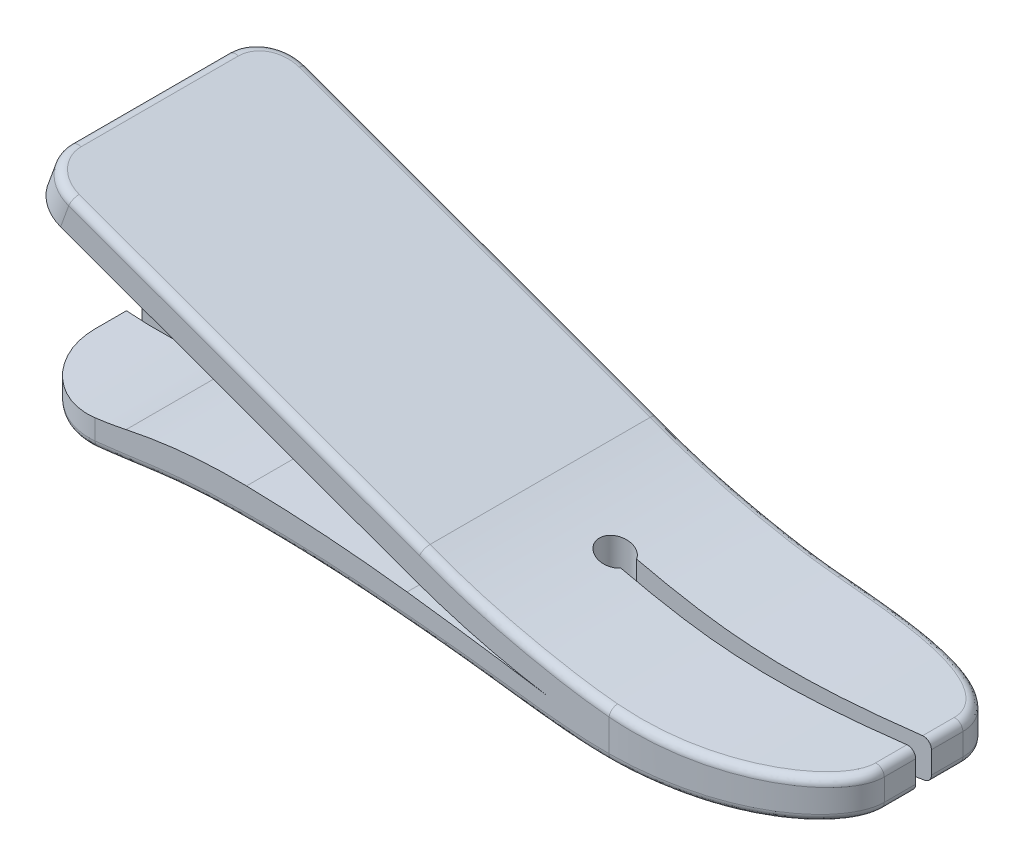
from build123d import *

# Parameters (mm, degrees)
BOSS_EXTRUDE1_DEPTH = 60
FILLET1_SIZE        = 50
FILLET1_SIZE_2      = 20
FILLET2_SIZE        = 50
FILLET2_SIZE_2      = 20
FILLET3_R           = 20
FILLET4_R           = 10
CUT_EXTRUDE1_REACH  = 293.942
FILLET5_R           = 2
FILLET6_R           = 2


with BuildPart() as part:
    # Sketch2 → Boss-Extrude1 (new body)
    with BuildSketch(Plane.XY):
        with BuildLine():
            Line((46.11, 139.37), (144.78, 103.46))
            ThreePointArc((144.78, 103.46), (161.762051902, 98.18308248), (179.17, 94.55))
            ThreePointArc((179.17, 94.55), (161.432071945, 97.216174398), (143.65, 99.57))
            ThreePointArc((143.65, 99.57), (123.262518813, 101.558086527), (102.8, 102.5))
            ThreePointArc((102.8, 102.5), (87.401684867, 101.929980177), (72.17, 99.6))
            ThreePointArc((72.17, 99.6), (58.279448043, 97.697985859), (44.26, 97.84))
            Line((44.26, 97.84), (44.26, 91.84))
            add(Edge.make_bspline(
                [(44.26, 91.84), (53.568594741, 89.698756815), (67.998612324, 91.470729353), (87.394745189, 94.232314563), (104.492018527, 94.636815565), (123.262783328, 94.257309157), (142.806208816, 92.718425614), (161.443067569, 90.828472369), (176.998235713, 88.653368455), (190.513379981, 87.509000731), (212.592867223, 87.865396449), (230.828259502, 89.479017692), (245.06, 92.26)],
                knots=[0, 0, 0, 0, 0.139004427, 0.215091652, 0.291514356, 0.393025138, 0.494409085, 0.583080072, 0.671707724, 0.72810505, 0.784647742, 1, 1, 1, 1], degree=3))
            Line((245.06, 92.26), (245.06, 96.26))
            Line((245.06, 96.26), (245.06, 101.76))
            add(Edge.make_bspline(
                [(245.06, 101.76), (230.79083083, 100.048831541), (212.495370684, 98.246073202), (190.474125137, 100.036354989), (172.105707333, 103.160026414), (157.74926796, 106.965732999), (147.515963148, 110.977613029)],
                knots=[0, 0, 0, 0, 0.436364932, 0.551892679, 0.667816032, 1, 1, 1, 1], degree=3))
            Line((147.515963148, 110.977613029), (48.845963148, 146.887613029))
            Line((48.845963148, 146.887613029), (46.11, 139.37))
        make_face()
    extrude(amount=BOSS_EXTRUDE1_DEPTH)

    # Fillet1
    # an asymmetric fillet: 50, 20 mm, written as the material it takes off along each edge
    with BuildSketch(Plane(origin=(245.06, 226.76, 60), x_dir=(-1, 0, 0), z_dir=(0, -1, 0))) as fillet1_piece_1:
        with BuildLine():
            Bezier((FILLET1_SIZE, 0), (0, 0), (0, FILLET1_SIZE_2), weights=[1, 0.707106781, 1])
            Line((0, FILLET1_SIZE_2), (0, 0))
            Line((0, 0), (FILLET1_SIZE, 0))
        make_face()
    extrude(amount=259.5, mode=Mode.SUBTRACT)

    # Fillet2
    # an asymmetric fillet: 50, 20 mm, written as the material it takes off along each edge
    with BuildSketch(Plane(origin=(245.06, -32.74, 0), x_dir=(-1, 0, 0), z_dir=(0, 1, 0))) as fillet2_piece_1:
        with BuildLine():
            Bezier((FILLET2_SIZE, 0), (0, 0), (0, FILLET2_SIZE_2), weights=[1, 0.707106781, 1])
            Line((0, FILLET2_SIZE_2), (0, 0))
            Line((0, 0), (FILLET2_SIZE, 0))
        make_face()
    extrude(amount=259.5, mode=Mode.SUBTRACT)

    # Fillet3
    fillet3_edges = [part.edges().sort_by_distance(p)[0] for p in [
        (44.26, 94.84, 0),
        (44.26, 94.84, 60),
    ]]
    fillet(fillet3_edges, radius=FILLET3_R)

    # Fillet4
    fillet4_edges = [part.edges().sort_by_distance(p)[0] for p in [
        (47.477981574, 143.128806514, 0),
        (47.477981574, 143.128806514, 60),
    ]]
    fillet(fillet4_edges, radius=FILLET4_R)

    # Sketch3 → Cut-Extrude1 (cut, up to next)
    with BuildSketch(Plane(origin=(0, 0, 0), x_dir=(1, 0, 0), z_dir=(0, 1, 0)), mode=Mode.PRIVATE) as cut_extrude1_sk1:
        with BuildLine():
            Line((245.06, -28), (245.06, -32))
            Line((245.06, -32), (170.06, -32))
            ThreePointArc((170.06, -32), (162.595898385, -30), (170.06, -28))
            Line((170.06, -28), (245.06, -28))
        make_face()
    cut_extrude1_tool1 = extrude(cut_extrude1_sk1.sketch, amount=CUT_EXTRUDE1_REACH, mode=Mode.PRIVATE) & part.part
    # Sketch3 → Cut-Extrude1 (cut, up to next)
    with BuildSketch(Plane(origin=(0, 0, 0), x_dir=(1, 0, 0), z_dir=(0, 1, 0)), mode=Mode.PRIVATE) as cut_extrude1_sk2:
        with BuildLine():
            Line((44.26, -28), (44.26, -32))
            Line((44.26, -32), (119.26, -32))
            ThreePointArc((119.26, -32), (126.724101615, -30), (119.26, -28))
            Line((119.26, -28), (44.26, -28))
        make_face()
    cut_extrude1_tool2 = extrude(cut_extrude1_sk2.sketch, amount=CUT_EXTRUDE1_REACH, mode=Mode.PRIVATE) & part.part
    add(cut_extrude1_tool1.solids().sort_by_distance((201.811867, 0, 30))[0], mode=Mode.SUBTRACT)
    add(cut_extrude1_tool2.solids().sort_by_distance((87.508133, 0, 30))[0], mode=Mode.SUBTRACT)

    # Fillet5
    fillet5_edges = [part.edges().sort_by_distance(p)[0] for p in [
        (245.06, 101.76, 24),
        (170.923241212, 103.809341276, 0),
        (102.879471291, 127.222636061, 0),
        (51.598285496, 145.885931712, 2.928932188),
        (48.845963148, 146.887613029, 30),
        (51.598285496, 145.885931712, 57.071067812),
        (245.06, 101.76, 36),
        (223.547592091, 99.628804251, 3.563664197),
        (102.879471291, 127.222636061, 60),
        (170.923241212, 103.809341276, 60),
        (223.5475921, 99.628804252, 56.436335843),
    ]]
    fillet(fillet5_edges, radius=FILLET5_R)

    # Fillet6
    fillet6_edges = [part.edges().sort_by_distance(p)[0] for p in [
        (44.26, 91.84, 24),
        (50.114371183, 90.897528507, 5.861358426),
        (129.712490512, 93.683124893, 0),
        (245.06, 92.26, 24),
        (245.06, 92.26, 36),
        (44.26, 91.84, 36),
        (50.114370844, 90.89752854, 54.138641235),
        (129.712490512, 93.683124893, 60),
        (223.585389771, 89.132164891, 3.574156278),
        (223.585386033, 89.132164516, 56.425844769),
    ]]
    fillet(fillet6_edges, radius=FILLET6_R)


solid = part.part
